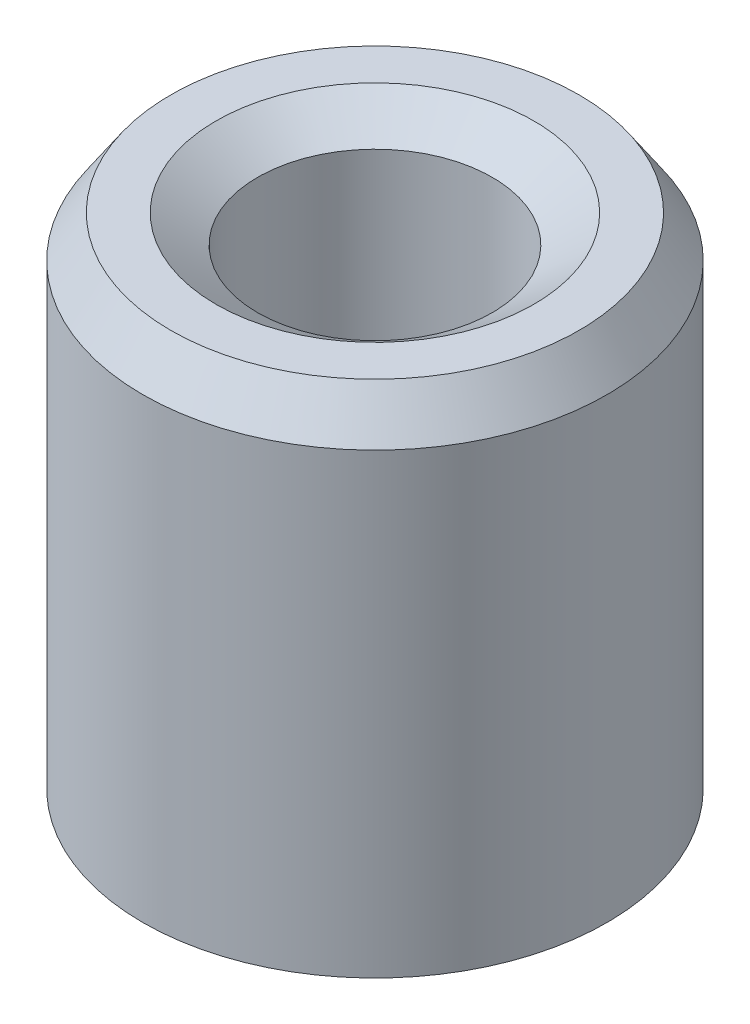
from build123d import *
from OCP.BRepFilletAPI import BRepFilletAPI_MakeChamfer

# Parameters (mm, degrees)
SKETCH1_R           = 5
BOSS_EXTRUDE1_DEPTH = 11.347145572
SKETCH2_R           = 2.527037211
CUT_EXTRUDE1_DEPTH  = 14.37003039
CHAMFER1_SIZE       = 0.896111023
CHAMFER1_SIZE2      = 0.603669941


with BuildPart() as part:
    # Sketch1 → Boss-Extrude1 (new body)
    with BuildSketch(Plane(origin=(0, 0, 0), x_dir=(1, 0, 0), z_dir=(0, 1, 0))):
        Circle(SKETCH1_R)
    extrude(amount=BOSS_EXTRUDE1_DEPTH)

    # Sketch2 → Cut-Extrude1 (cut, through all)
    with BuildSketch(Plane(origin=(0, 0, 0), x_dir=(1, 0, 0), z_dir=(0, 1, 0))):
        Circle(SKETCH2_R)
    extrude(amount=CUT_EXTRUDE1_DEPTH, mode=Mode.SUBTRACT)

    # Chamfer1: one chamfer whose edges measure the first distance from different faces: ONE call of the kernel's chamfer builder (chamfer() names one face for all edges)
    chamfer1_edges_1 = [part.edges().sort_by_distance(p)[0] for p in [
        (-2.527037211, 11.347145572, 0),
    ]]
    chamfer1_side_1 = [part.faces().sort_by_distance(p)[0] for p in [
        (-4.858578644, 11.347145572, 0),
    ]]
    chamfer1_edges_2 = [part.edges().sort_by_distance(p)[0] for p in [
        (-2.527037211, 0, 0),
    ]]
    chamfer1_side_2 = [part.faces().sort_by_distance(p)[0] for p in [
        (-2.527037211, 5.673572786, 0),
    ]]
    chamfer1_edges_3 = [part.edges().sort_by_distance(p)[0] for p in [
        (-5, 0, 0),
    ]]
    chamfer1_side_3 = [part.faces().sort_by_distance(p)[0] for p in [
        (-4.858578644, 0, 0),
    ]]
    chamfer1_edges_4 = [part.edges().sort_by_distance(p)[0] for p in [
        (-5, 11.347145572, 0),
    ]]
    chamfer1_side_4 = [part.faces().sort_by_distance(p)[0] for p in [
        (-5, 5.673572786, 0),
    ]]
    chamfer1 = BRepFilletAPI_MakeChamfer(part.part.solid().wrapped)
    for e in chamfer1_edges_1:
        chamfer1.Add(CHAMFER1_SIZE, CHAMFER1_SIZE2, e.wrapped, chamfer1_side_1[0].wrapped)  # the first distance lies on this face
    for e in chamfer1_edges_2:
        chamfer1.Add(CHAMFER1_SIZE, CHAMFER1_SIZE2, e.wrapped, chamfer1_side_2[0].wrapped)  # the first distance lies on this face
    for e in chamfer1_edges_3:
        chamfer1.Add(CHAMFER1_SIZE, CHAMFER1_SIZE2, e.wrapped, chamfer1_side_3[0].wrapped)  # the first distance lies on this face
    for e in chamfer1_edges_4:
        chamfer1.Add(CHAMFER1_SIZE, CHAMFER1_SIZE2, e.wrapped, chamfer1_side_4[0].wrapped)  # the first distance lies on this face
    add(Compound.cast(chamfer1.Shape()), mode=Mode.REPLACE)


solid = part.part
